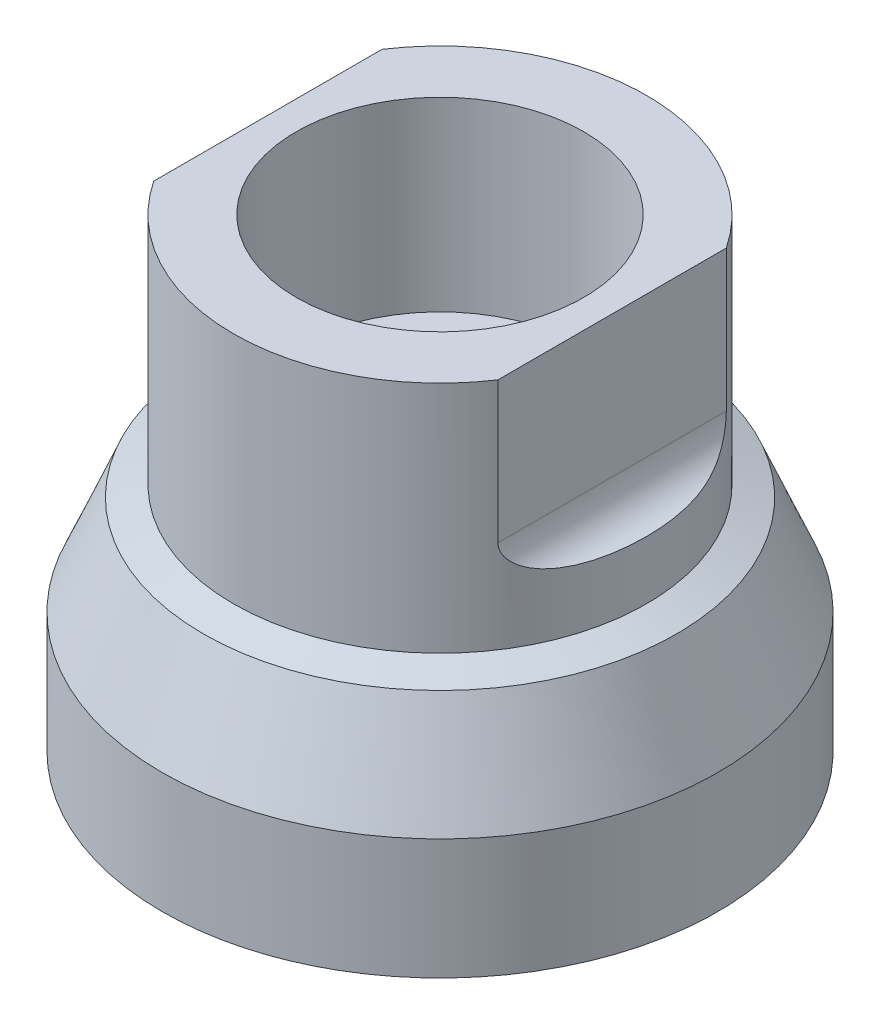
from build123d import *

# Parameters (mm, degrees)
CIRPATTERN1_COUNT       = 3
SKETCH13_R              = 10.6045
CUT_EXTRUDE1_DEPTH      = 13.716
CUT_EXTRUDE4_DEPTH      = 36.716886893
CUT_EXTRUDE4_DEPTH_BACK = 36.716886893
SKETCH17_W              = 2.54
SKETCH17_H              = 12.954
FILLET1_R               = 2.54
SCALE1_SCALE            = 1.5


with BuildPart() as part:
    # Sketch1 → Revolve1 (revolve)
    with BuildSketch(Plane(origin=(0, 0, 0), x_dir=(0, 0, -1), z_dir=(1, 0, 0))):
        Polygon((0, 17.2593), (-15.24, 17.2593), (-15.24, 0), (-17.4625, -0.808923846), (-20.5105, -8.1407), (-20.5105, -17.0307), (-8.784525723, -20.8407), (0, -20.8407), align=None)
    revolve(axis=Axis((0, 17.2593, 0), (0, -1, 0)))

    # Sketch4 → Cut-Revolve2 (revolve, cut)
    with BuildSketch(Plane(origin=(-5.871974582, 1.907920197, 0), x_dir=(0, 0, -1), z_dir=(0.9510565162951535, -0.3090169943749475, 0)), mode=Mode.PRIVATE) as cut_revolve2_sk:
        Polygon((0, -4.755251275), (-6.8326, -8.388209138), (-6.8326, -25.075251275), (0, -25.075251275), align=None)
    cut_revolve2 = revolve(cut_revolve2_sk.sketch.rotate(Axis((-13.620653364, -21.940060926, 0), (0.3090169943749475, 0.9510565162951535, 0)), 90), axis=Axis((-13.620653364, -21.940060926, 0), (0.3090169943749475, 0.9510565162951535, 0)), mode=Mode.SUBTRACT)

    # Sketch10 → Cut-Revolve4 (revolve, cut)
    with BuildSketch(Plane.XY, mode=Mode.PRIVATE) as cut_revolve4_sk:
        Polygon((-20.5105, -17.0307), (-16.663911615, -15.070765324), (-11.892423344, -16.621115844), (-12.835750198, -19.524377374), (-13.779077053, -22.427638905), (-24.357088385, -18.990634676), align=None)
    cut_revolve4 = revolve(cut_revolve4_sk.sketch.rotate(Axis((-13.779077053, -22.427638905, 0), (0.3090169943749473, 0.9510565162951536, 0)), 180), axis=Axis((-13.779077053, -22.427638905, 0), (0.3090169943749473, 0.9510565162951536, 0)), mode=Mode.SUBTRACT)

    # CirPattern1: Cut-Revolve2, Cut-Revolve4 ×3 about axis
    cirpattern1_axis = Axis((0, -0.808923846, 0), (0, -1, 0))
    add([cut_revolve2.rotate(cirpattern1_axis, i * 360 / CIRPATTERN1_COUNT) for i in range(1, CIRPATTERN1_COUNT)], mode=Mode.SUBTRACT)
    add([cut_revolve4.rotate(cirpattern1_axis, i * 360 / CIRPATTERN1_COUNT) for i in range(1, CIRPATTERN1_COUNT)], mode=Mode.SUBTRACT)

    # Sketch2 → Cut-Revolve1 (revolve, cut)
    with BuildSketch(Plane.XY):
        Polygon((0, -10.6807), (-7.8994, -6.480514516), (-7.8994, 17.2593), (0, 17.2593), align=None)
    revolve(axis=Axis((0, 17.2593, 0), (0, -1, 0)), mode=Mode.SUBTRACT)

    # Sketch13 → Cut-Extrude1 (cut)
    with BuildSketch(Plane(origin=(0, 17.2593, 0), x_dir=(1, 0, 0), z_dir=(0, 1, 0))):
        with Locations(Location((0, 0, 0), (0, 0, 270))):
            Circle(SKETCH13_R)
    extrude(amount=-CUT_EXTRUDE1_DEPTH, mode=Mode.SUBTRACT)

    # Sketch17 → Cut-Extrude4 (cut, two sides: drawn at the far end of the back side and taken through both)
    with BuildSketch(Plane.XY.offset(-CUT_EXTRUDE4_DEPTH_BACK)):
        with Locations((-13.97, 10.7823)):
            Rectangle(SKETCH17_W, SKETCH17_H)
        with Locations((13.97, 10.7823)):
            Rectangle(SKETCH17_W, SKETCH17_H)
    extrude(amount=CUT_EXTRUDE4_DEPTH + CUT_EXTRUDE4_DEPTH_BACK, mode=Mode.SUBTRACT)

    # Fillet1
    fillet1_edges = [part.edges().sort_by_distance(p)[0] for p in [
        (12.7, 4.3053, 0),
        (-12.7, 4.3053, 0),
    ]]
    fillet(fillet1_edges, radius=FILLET1_R - 0.0001)  # a hair under: the kernel refuses the full size


with BuildPart() as part_1:
    # Scale1: scaled about (1e-09, -4.662732897, -2.87e-07)
    add(part.part.scale(SCALE1_SCALE).moved(Location((-1e-09, 2.331366448, 1.44e-07))))


solid = part_1.part
